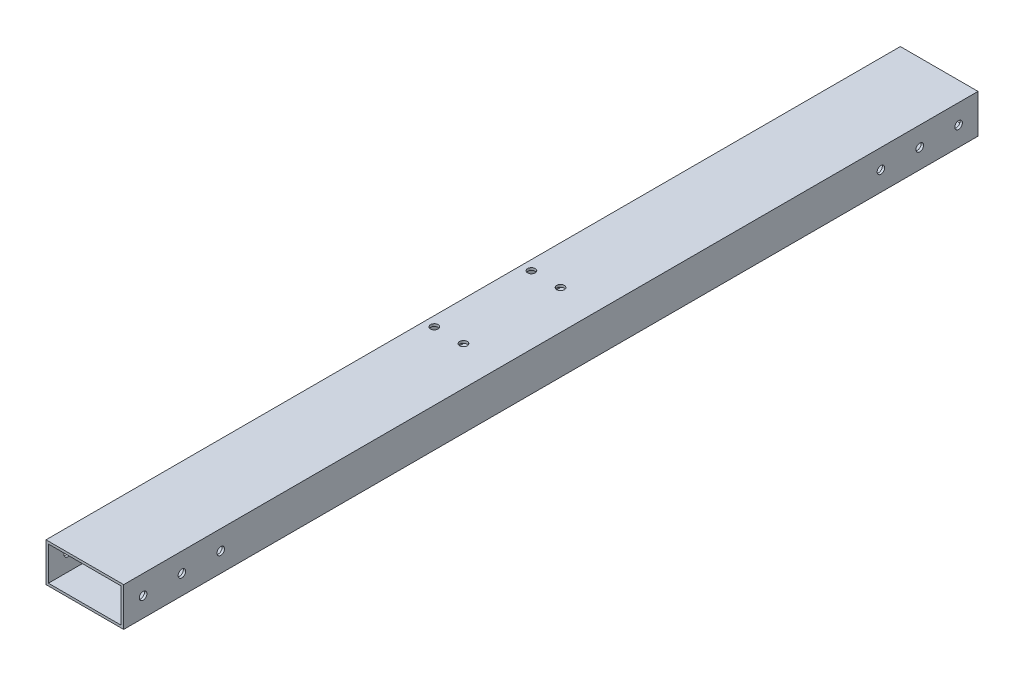
from build123d import *

# Parameters (mm, degrees)
SKETCH1_W               = 50.8
SKETCH1_H               = 25.4
BOSS_EXTRUDE1_DEPTH     = 279.4
SHELL1_T                = -1.5875
CUT_EXTRUDE1_DEPTH      = 281.839473721
CUT_EXTRUDE1_DEPTH_BACK = 281.839473721
SKETCH3_R               = 2.4892
CUT_EXTRUDE2_DEPTH      = 281.839473721
CUT_EXTRUDE2_DEPTH_BACK = 281.839473721
SKETCH4_R               = 2.4892


with BuildPart() as part:
    # Sketch1 → Boss-Extrude1 (new, symmetric)
    with BuildSketch(Plane.XY):
        Rectangle(SKETCH1_W, SKETCH1_H)
    extrude(amount=BOSS_EXTRUDE1_DEPTH, both=True)

    # Shell1
    shell1_openings = [part.faces().sort_by_distance(p)[0] for p in [
        (0, 0, -279.4),
        (0, 0, 279.4),
    ]]
    offset(amount=SHELL1_T, openings=shell1_openings, kind=Kind.INTERSECTION)

    # Sketch3 → Cut-Extrude1 (cut, two sides: drawn at the far end of the back side and taken through both)
    with BuildSketch(Plane(origin=(0, 0, 0), x_dir=(0, 0, -1), z_dir=(1, 0, 0)).offset(-CUT_EXTRUDE1_DEPTH_BACK)):
        with Locations((-266.7, 0)):
            Circle(SKETCH3_R)
        with Locations((-241.3, 0)):
            Circle(SKETCH3_R)
        with Locations((-215.9, 0)):
            Circle(SKETCH3_R)
        with Locations((215.9, 0)):
            Circle(SKETCH3_R)
        with Locations((241.3, 0)):
            Circle(SKETCH3_R)
        with Locations((266.7, 0)):
            Circle(SKETCH3_R)
    extrude(amount=CUT_EXTRUDE1_DEPTH + CUT_EXTRUDE1_DEPTH_BACK, mode=Mode.SUBTRACT)

    # Sketch4 → Cut-Extrude2 (cut, two sides: drawn at the far end of the back side and taken through both)
    with BuildSketch(Plane(origin=(0, 0, 0), x_dir=(1, 0, 0), z_dir=(0, 1, 0)).offset(-CUT_EXTRUDE2_DEPTH_BACK)):
        with Locations((0, -31.75)):
            Circle(SKETCH4_R)
        with Locations((-19.05, -31.75)):
            Circle(SKETCH4_R)
        with Locations((0, 31.75)):
            Circle(SKETCH4_R)
        with Locations((-19.05, 31.75)):
            Circle(SKETCH4_R)
    extrude(amount=CUT_EXTRUDE2_DEPTH + CUT_EXTRUDE2_DEPTH_BACK, mode=Mode.SUBTRACT)


solid = part.part
